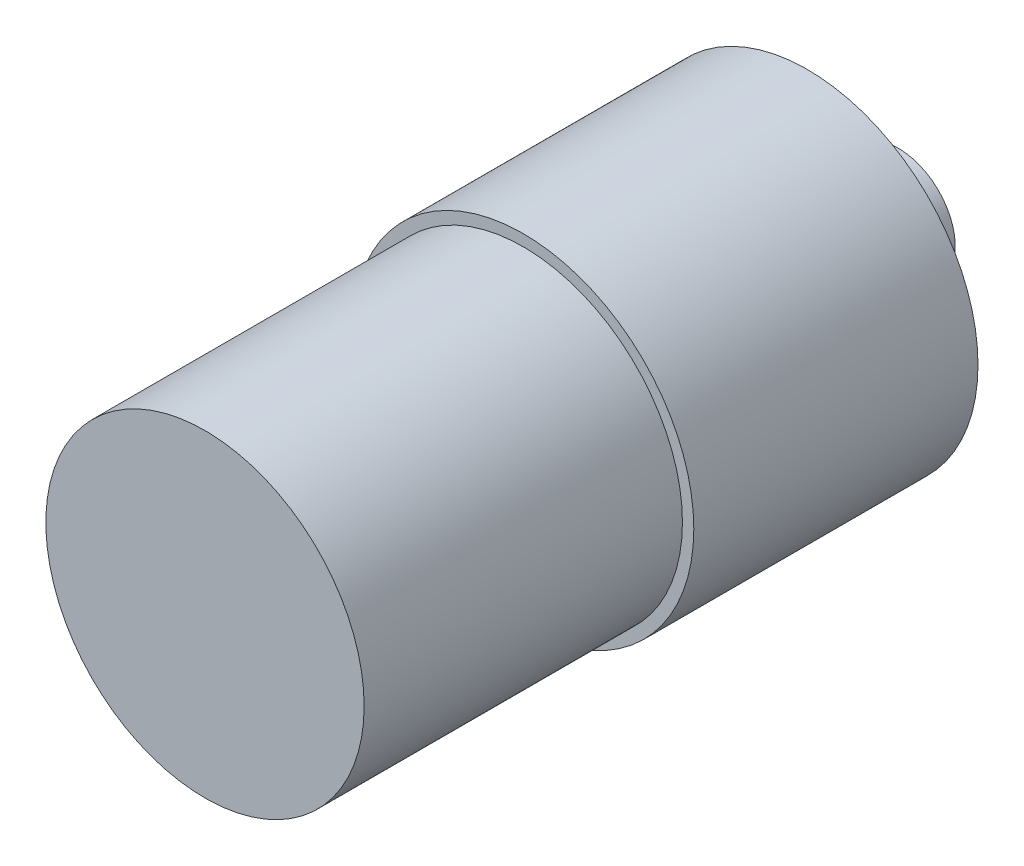
from build123d import *

# Parameters (mm, degrees)
SKETCH1_R                      = 15
BOSS_EXTRUDE1_DEPTH            = 25
SKETCH2_R                      = 14
BOSS_EXTRUDE2_DEPTH            = 28
SKETCH3_R                      = 5
BOSS_EXTRUDE3_DEPTH            = 8
F_3_3_3_3_DIAMETER_HOLE1_D     = 3.3
F_3_3_3_3_DIAMETER_HOLE1_DEPTH = 8
F_3_3_3_3_DIAMETER_HOLE1_TIP   = 0.991420021
THREAD2_PITCH                  = 0.7


with BuildPart() as part:
    # Sketch1 → Boss-Extrude1 (new body)
    with BuildSketch(Plane.XY):
        Circle(SKETCH1_R)
    extrude(amount=BOSS_EXTRUDE1_DEPTH)

    # Sketch2 → Boss-Extrude2 (add)
    with BuildSketch(Plane.XY.offset(25)):
        Circle(SKETCH2_R)
    extrude(amount=BOSS_EXTRUDE2_DEPTH)

    # Sketch3 → Boss-Extrude3 (add)
    with BuildSketch(Plane(origin=(0, 0, 0), x_dir=(-1, 0, 0), z_dir=(0, 0, -1))):
        Circle(SKETCH3_R)
    extrude(amount=BOSS_EXTRUDE3_DEPTH)

    # Ø3.3 (3.3) Diameter Hole1
    with Locations(Plane(origin=(0, 0, -8), x_dir=(-1, 0, 0), z_dir=(0, 0, -1))):
        with Locations((0, 0)):
            Hole(F_3_3_3_3_DIAMETER_HOLE1_D / 2, depth=F_3_3_3_3_DIAMETER_HOLE1_DEPTH)
            with Locations((0, 0, -(F_3_3_3_3_DIAMETER_HOLE1_DEPTH + F_3_3_3_3_DIAMETER_HOLE1_TIP / 2))):  # 118° drill point
                Cone(0, F_3_3_3_3_DIAMETER_HOLE1_D / 2, F_3_3_3_3_DIAMETER_HOLE1_TIP, mode=Mode.SUBTRACT)

    # Thread2: the profile of Thread Profile2 profile screwed along a right-hand helix of 11.428571 turns, 6 arcs to a turn; built about Z, then put on its axis
    thread2_z = Axis((0, 0, 0), (0, 0, 1))
    thread2_corners = [(1.6497, 0, -0.000173205), (2.028886112, 0, 0.218749999), (2.028886112, 0, 0.306249999), (1.6497, 0, 0.525173203)]
    with BuildLine(mode=Mode.PRIVATE) as thread2_profile:
        Line(thread2_corners[0], thread2_corners[1])
        Line(thread2_corners[1], thread2_corners[2])
        Line(thread2_corners[2], thread2_corners[3])
        Line(thread2_corners[3], thread2_corners[0])
    thread2_cap = Face(thread2_profile.wire())
    thread2_turn_angles = [0, 30, 60, 90, 120, 150, 180, 210, 240, 270, 300, 330, 360]
    thread2_turn_weights = [1, 0.8660254037844387, 1, 0.8660254037844387, 1, 0.8660254037844387, 1, 0.8660254037844387, 1, 0.8660254037844387, 1, 0.8660254037844387, 1]
    thread2_turn_rails = [Edge.make_bspline([Vector(p[0], p[1], 0).rotate(thread2_z, thread2_turn_angles[k]) / thread2_turn_weights[k] + Vector(0, 0, p[2] + THREAD2_PITCH * thread2_turn_angles[k] / 360) for k in range(13)], [0, 0, 0, 1, 1, 2, 2, 3, 3, 4, 4, 5, 5, 6, 6, 6], 2, thread2_turn_weights) for p in thread2_corners]
    thread2_turn_sides = [Face.make_surface_from_curves(thread2_turn_rails[p[0]], thread2_turn_rails[p[1]]) for p in [(0, 1), (1, 2), (2, 3), (3, 0)]]
    thread2_last_angles = [3960, 3990, 4020, 4050, 4080, 4097.142857143, 4114.285714286]
    thread2_last_weights = [1, 0.8660254037844387, 1, 0.8660254037844387, 1, 0.9555728057861397, 1]
    thread2_last_rails = [Edge.make_bspline([Vector(p[0], p[1], 0).rotate(thread2_z, thread2_last_angles[k]) / thread2_last_weights[k] + Vector(0, 0, p[2] + THREAD2_PITCH * thread2_last_angles[k] / 360) for k in range(7)], [0, 0, 0, 1, 1, 2, 2, 3, 3, 3], 2, thread2_last_weights) for p in thread2_corners]
    thread2_last_sides = [Face.make_surface_from_curves(thread2_last_rails[p[0]], thread2_last_rails[p[1]]) for p in [(0, 1), (1, 2), (2, 3), (3, 0)]]
    thread2 = Plane(origin=(0, 0, -8), x_dir=(1, 0, 0), z_dir=(0, 0, 1)) * Solid(Shell([*[p.moved(Location((0, 0, THREAD2_PITCH * i))) for i in range(11) for p in thread2_turn_sides], *thread2_last_sides, thread2_cap, thread2_cap.rotate(thread2_z, 4114.285714286).moved(Location((0, 0, THREAD2_PITCH * 4114.285714286 / 360)))]))
    add(thread2, mode=Mode.SUBTRACT)


solid = part.part
